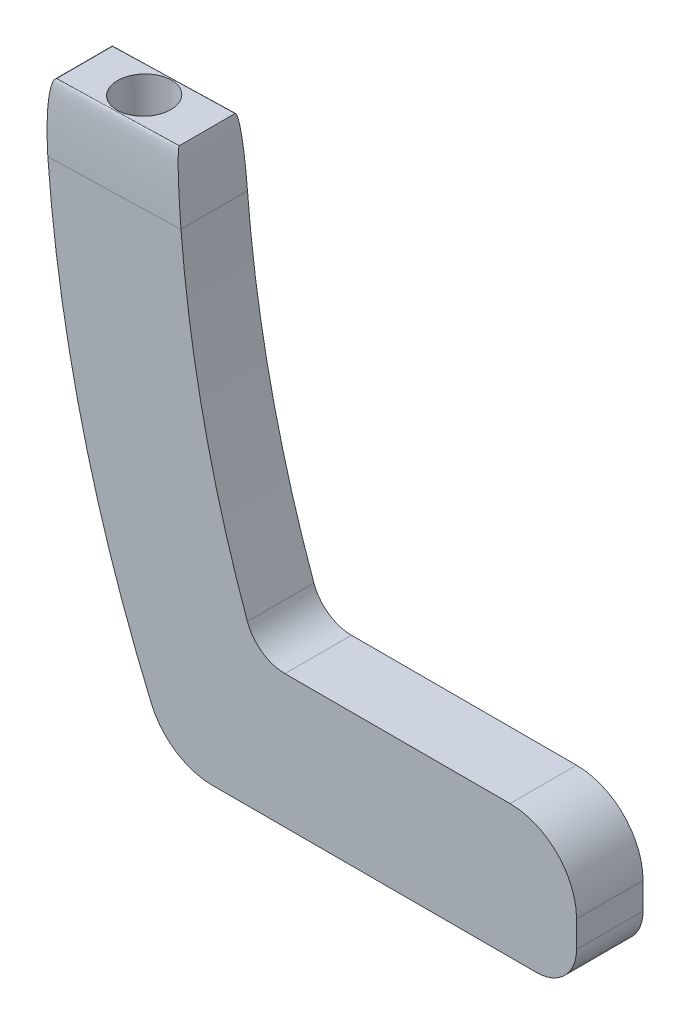
from build123d import *

# Parameters (mm, degrees)
EXTRUDE_THIN1_DEPTH = 5
SKETCH2_R           = 2
CUT_EXTRUDE1_DEPTH  = 3
FILLET1_R           = 5
FILLET2_R           = 3
FILLET3_R           = 3
FILLET5_R           = 5


with BuildPart() as part:
    # Sketch1 → Extrude-Thin1 (new body)
    with BuildSketch(Plane.XY):
        with BuildLine():
            ThreePointArc((0, 0), (1.709468812, -15.258106238), (6, -30))
            Line((6, -30), (30, -30))
            Line((30, -30), (30, -40))
            Line((30, -40), (-0.59396654, -40))
            ThreePointArc((-0.59396654, -40), (-7.355075067, -20.616040357), (-9.996685535, -0.257445757))
            Line((-9.996685535, -0.257445757), (0, 0))
        make_face()
    extrude(amount=EXTRUDE_THIN1_DEPTH)

    # Sketch2 → Cut-Extrude1 (cut)
    with BuildSketch(Plane(origin=(0, 0, 0), x_dir=(1, 0, 0), z_dir=(0, 1, 0))):
        with Locations(Location((-4.998342767, -2.5, 0), (0, 0, 270))):
            Circle(SKETCH2_R)
    extrude(amount=-CUT_EXTRUDE1_DEPTH, mode=Mode.SUBTRACT)

    # Fillet1
    fillet1_edges = [part.edges().sort_by_distance(p)[0] for p in [
        (30, -30, 2.5),
    ]]
    fillet(fillet1_edges, radius=FILLET1_R)

    # Fillet2
    fillet2_edges = [part.edges().sort_by_distance(p)[0] for p in [
        (30, -40, 2.5),
    ]]
    fillet(fillet2_edges, radius=FILLET2_R)

    # Fillet3
    fillet3_edges = [part.edges().sort_by_distance(p)[0] for p in [
        (6, -30, 2.5),
    ]]
    fillet(fillet3_edges, radius=FILLET3_R)

    # Fillet4
    # a fillet whose section is not a circle: 5, 0.4 mm, written as the material it takes off along each edge (its section moved 0.00015 mm through the faces so that the kernel can cut it)
    with BuildSketch(Plane(origin=(-22.492542459, -0.579252954, 0), x_dir=(0.02574457573397758, -0.9996685530315923, -2.999999998649999e-05), z_dir=(0.9996685534814432, 0.025744575745562638, 0))) as fillet4_piece_1:
        with BuildLine():
            Bezier((5.000000002, 0), (-0.000149995, 0.000150004), (-0.000162, -0.399999995), weights=[1, 0.707106781, 1])
            Line((-0.000162, -0.399999995), (-0.100162, -0.399996995))
            ThreePointArc((-0.100162, -0.399996995), (-0.100006, -0.199997), (-0.1, 3e-06))
            Line((-0.1, 3e-06), (3e-06, 0.1))
            ThreePointArc((3e-06, 0.1), (2.500002999, 0.099925), (5.000003002, 0.1))
            Line((5.000003002, 0.1), (5.000000002, 0))
        make_face()
    extrude(amount=35.000000011, mode=Mode.SUBTRACT)
    with BuildSketch(Plane(origin=(-9.996685535, -0.257445757, -12.554427483), x_dir=(0.9996611732267645, 0.026029574389313356, 0), z_dir=(0, 0, 1))) as fillet4_piece_2:
        with BuildLine():
            Bezier((0.526141916, 0), (-0.126969786, 0.000186198), (0.12506971, -5.02021329), weights=[1, 0.689048379, 1])
            Line((0.12506971, -5.02021329), (0.02519549, -5.025227283))
            ThreePointArc((0.02519549, -5.025227283), (-0.069016975, -2.513387959), (-0.099999996, 2.8509e-05))
            Line((-0.099999996, 2.8509e-05), (2.8509e-05, 0.099999996))
            ThreePointArc((2.8509e-05, 0.099999996), (0.263099446, 0.099924996), (0.526170426, 0.099999996))
            Line((0.526170426, 0.099999996), (0.526141916, 0))
        make_face()
    extrude(amount=30.108854967, mode=Mode.SUBTRACT)
    with BuildSketch(Plane(origin=(-22.492542459, -0.579252954, 5), x_dir=(-9.654215225776052e-06, 0.00037487568119717526, -0.9999999296875075), z_dir=(0.9996685534814432, 0.025744575745562638, 0))) as fillet4_piece_3:
        with BuildLine():
            Bezier((0.400000028, 0), (-0.000149944, 0.000150056), (-0.002025, -4.999999592), weights=[1, 0.707106781, 1])
            Line((-0.002025, -4.999999592), (-0.102024993, -4.999962092))
            ThreePointArc((-0.102024993, -4.999962092), (-0.100937493, -2.499962324), (-0.099999993, 3.75e-05))
            Line((-0.099999993, 3.75e-05), (3.75e-05, 0.099999993))
            ThreePointArc((3.75e-05, 0.099999993), (0.200037486, 0.099924993), (0.400037528, 0.099999993))
            Line((0.400037528, 0.099999993), (0.400000028, 0))
        make_face()
    extrude(amount=35.000000011, mode=Mode.SUBTRACT)
    with BuildSketch(Plane(origin=(0, 0, -12.449220075), x_dir=(0.05355702462204362, -0.9985647926467435, 0), z_dir=(0, 0, 1))) as fillet4_piece_4:
        with BuildLine():
            Bezier((4.97968803, 0), (-0.004005059, -0.138457778), (-0.00741229, -0.260833255), weights=[1, 0.72649212, 1])
            Line((-0.00741229, -0.260833255), (-0.107373553, -0.25805009))
            ThreePointArc((-0.107373553, -0.25805009), (-0.103592437, -0.12763555), (-0.099961262, 0.002783165))
            Line((-0.099961262, 0.002783165), (0.002783165, 0.099961262))
            ThreePointArc((0.002783165, 0.099961262), (2.489845983, 0.065307551), (4.976910885, 0.09996143))
            Line((4.976910885, 0.09996143), (4.97968803, 0))
        make_face()
    extrude(amount=29.898440151, mode=Mode.SUBTRACT)

    # Fillet5
    fillet5_edges = [part.edges().sort_by_distance(p)[0] for p in [
        (-0.59396654, -40, 2.5),
    ]]
    fillet(fillet5_edges, radius=FILLET5_R)


solid = part.part
